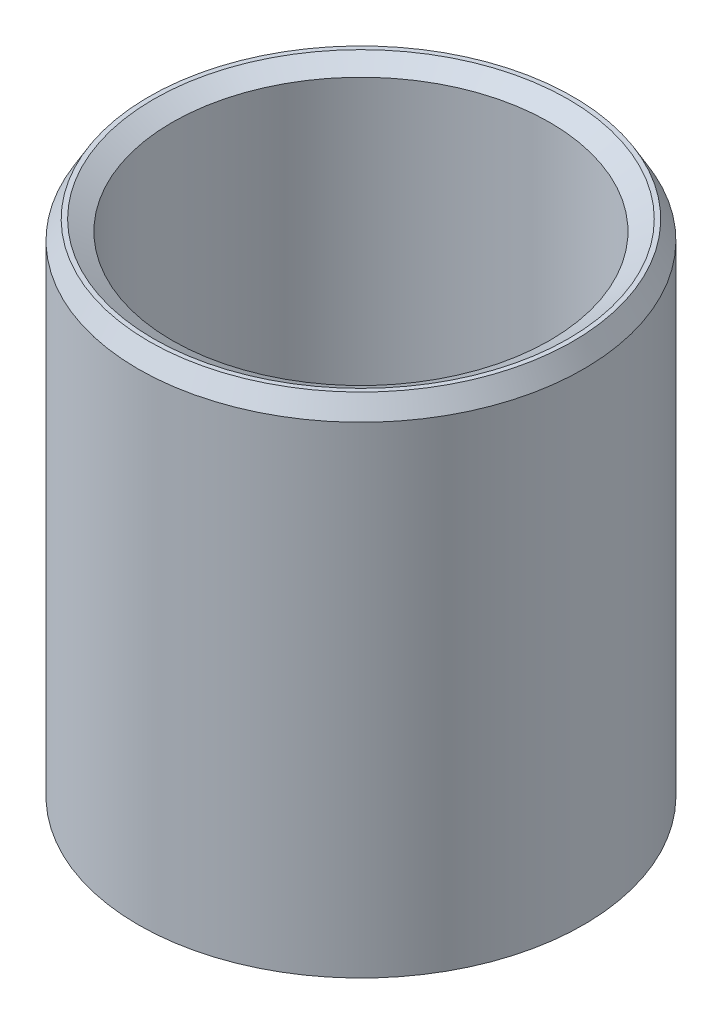
from build123d import *
from OCP.BRepFilletAPI import BRepFilletAPI_MakeChamfer

# Parameters (mm, degrees)
SKETCH1_R           = 42.5
BOSS_EXTRUDE1_DEPTH = 97.439081101
SKETCH2_R           = 36.037158308
CUT_EXTRUDE1_DEPTH  = 115.485258989
CHAMFER1_SIZE       = 3.546767021
CHAMFER1_SIZE2      = 2.047726895


with BuildPart() as part:
    # Sketch1 → Boss-Extrude1 (new body)
    with BuildSketch(Plane(origin=(0, 0, 0), x_dir=(1, 0, 0), z_dir=(0, 1, 0))):
        Circle(SKETCH1_R)
    extrude(amount=BOSS_EXTRUDE1_DEPTH)

    # Sketch2 → Cut-Extrude1 (cut, through all)
    with BuildSketch(Plane(origin=(0, 0, 0), x_dir=(1, 0, 0), z_dir=(0, 1, 0))):
        Circle(SKETCH2_R)
    extrude(amount=CUT_EXTRUDE1_DEPTH, mode=Mode.SUBTRACT)

    # Chamfer1: one chamfer whose edges measure the first distance from different faces: ONE call of the kernel's chamfer builder (chamfer() names one face for all edges)
    chamfer1_edges_1 = [part.edges().sort_by_distance(p)[0] for p in [
        (-36.037158308, 97.439081101, 0),
    ]]
    chamfer1_side_1 = [part.faces().sort_by_distance(p)[0] for p in [
        (-41.297918472, 97.439081101, 0),
    ]]
    chamfer1_edges_2 = [part.edges().sort_by_distance(p)[0] for p in [
        (-36.037158308, 0, 0),
    ]]
    chamfer1_side_2 = [part.faces().sort_by_distance(p)[0] for p in [
        (-36.037158308, 48.71954055, 0),
    ]]
    chamfer1_edges_3 = [part.edges().sort_by_distance(p)[0] for p in [
        (-42.5, 0, 0),
    ]]
    chamfer1_side_3 = [part.faces().sort_by_distance(p)[0] for p in [
        (-41.297918472, 0, 0),
    ]]
    chamfer1_edges_4 = [part.edges().sort_by_distance(p)[0] for p in [
        (-42.5, 97.439081101, 0),
    ]]
    chamfer1_side_4 = [part.faces().sort_by_distance(p)[0] for p in [
        (-42.5, 48.71954055, 0),
    ]]
    chamfer1 = BRepFilletAPI_MakeChamfer(part.part.solid().wrapped)
    for e in chamfer1_edges_1:
        chamfer1.Add(CHAMFER1_SIZE, CHAMFER1_SIZE2, e.wrapped, chamfer1_side_1[0].wrapped)  # the first distance lies on this face
    for e in chamfer1_edges_2:
        chamfer1.Add(CHAMFER1_SIZE, CHAMFER1_SIZE2, e.wrapped, chamfer1_side_2[0].wrapped)  # the first distance lies on this face
    for e in chamfer1_edges_3:
        chamfer1.Add(CHAMFER1_SIZE, CHAMFER1_SIZE2, e.wrapped, chamfer1_side_3[0].wrapped)  # the first distance lies on this face
    for e in chamfer1_edges_4:
        chamfer1.Add(CHAMFER1_SIZE, CHAMFER1_SIZE2, e.wrapped, chamfer1_side_4[0].wrapped)  # the first distance lies on this face
    add(Compound.cast(chamfer1.Shape()), mode=Mode.REPLACE)


solid = part.part
